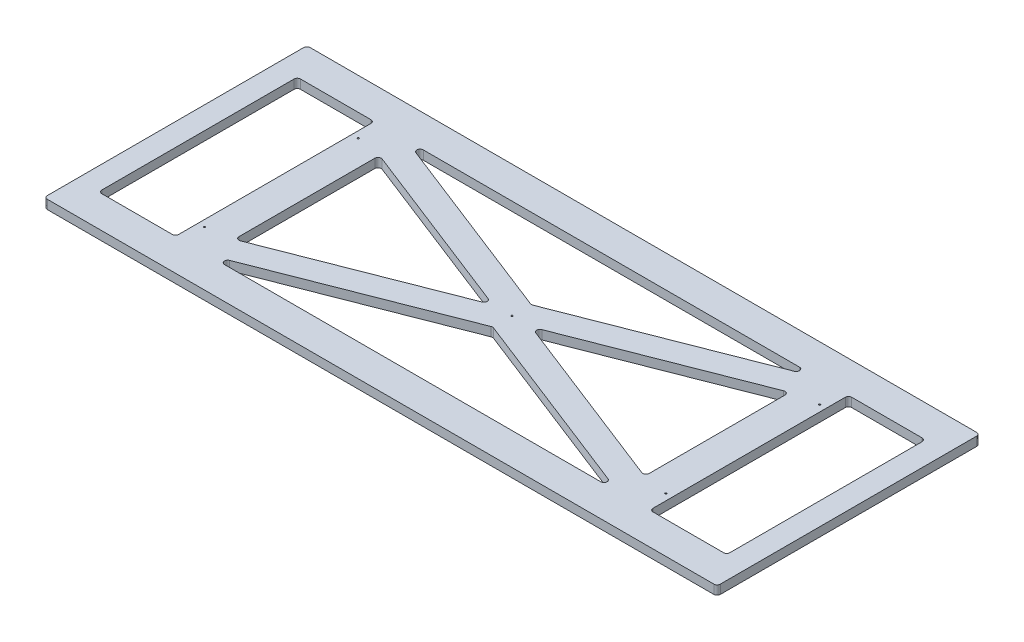
from build123d import *

# Parameters (mm, degrees)
SKETCH1_W                    = 1333.5
SKETCH1_H                    = 520.7
BOSS_EXTRUDE1_DEPTH          = 17.78
FILLET1_R                    = 6.35
F_1_8_0_125_DIAMETER_HOLE1_D = 3.175
SKETCH5_W                    = 152.4
SKETCH5_H                    = 393.7
CUT_EXTRUDE1_DEPTH           = 716.998473043
FILLET2_R                    = 6.35


with BuildPart() as part:
    # Sketch1 → Boss-Extrude1 (new body)
    with BuildSketch(Plane(origin=(0, 0, 0), x_dir=(1, 0, 0), z_dir=(0, 1, 0))):
        Rectangle(SKETCH1_W, SKETCH1_H)
    extrude(amount=BOSS_EXTRUDE1_DEPTH)

    # Fillet1
    fillet1_edges = [part.edges().sort_by_distance(p)[0] for p in [
        (-666.75, 8.89, 260.35),
        (-666.75, 8.89, -260.35),
        (666.75, 8.89, -260.35),
        (666.75, 8.89, 260.35),
    ]]
    fillet(fillet1_edges, radius=FILLET1_R)

    # 1/8 (0.125) Diameter Hole1 (through all)
    with Locations(Plane(origin=(0, 17.78, 0), x_dir=(1, 0, 0), z_dir=(0, 1, 0))):
        with Locations((0, 0), (457.2, 152.4), (-457.2, -152.4), (-457.2, 152.4), (457.2, -152.4)):
            Hole(F_1_8_0_125_DIAMETER_HOLE1_D / 2)

    # Sketch5 → Cut-Extrude1 (cut, through all)
    with BuildSketch(Plane(origin=(0, 17.78, 0), x_dir=(1, 0, 0), z_dir=(0, 1, 0))):
        Polygon((-406.4, 196.85), (406.4, 196.85), (0, 38.1), align=None)
        Polygon((0, -38.1), (-406.4, -196.85), (406.4, -196.85), align=None)
        Polygon((406.4, 143.8671875), (406.4, -143.8671875), (38.1, 0), align=None)
        Polygon((-406.4, 143.8671875), (-38.1, 0), (-406.4, -143.8671875), align=None)
        with Locations((546.1, 0)):
            Rectangle(SKETCH5_W, SKETCH5_H)
        with Locations((-546.1, 0)):
            Rectangle(SKETCH5_W, SKETCH5_H)
    extrude(amount=-CUT_EXTRUDE1_DEPTH, mode=Mode.SUBTRACT)

    # Fillet2
    fillet2_edges = [part.edges().sort_by_distance(p)[0] for p in [
        (469.9, 8.89, -196.85),
        (469.9, 8.89, 196.85),
        (622.3, 8.89, 196.85),
        (406.4, 8.89, 143.8671875),
        (406.4, 8.89, 196.85),
        (622.3, 8.89, -196.85),
        (406.4, 8.89, -143.8671875),
        (406.4, 8.89, -196.85),
        (38.1, 8.89, 0),
        (0, 8.89, 38.1),
        (0, 8.89, -38.1),
        (-38.1, 8.89, 0),
        (-406.4, 8.89, 196.85),
        (-406.4, 8.89, -196.85),
        (-406.4, 8.89, -143.8671875),
        (-406.4, 8.89, 143.8671875),
        (-622.3, 8.89, 196.85),
        (-469.9, 8.89, 196.85),
        (-469.9, 8.89, -196.85),
        (-622.3, 8.89, -196.85),
    ]]
    fillet(fillet2_edges, radius=FILLET2_R)


solid = part.part
